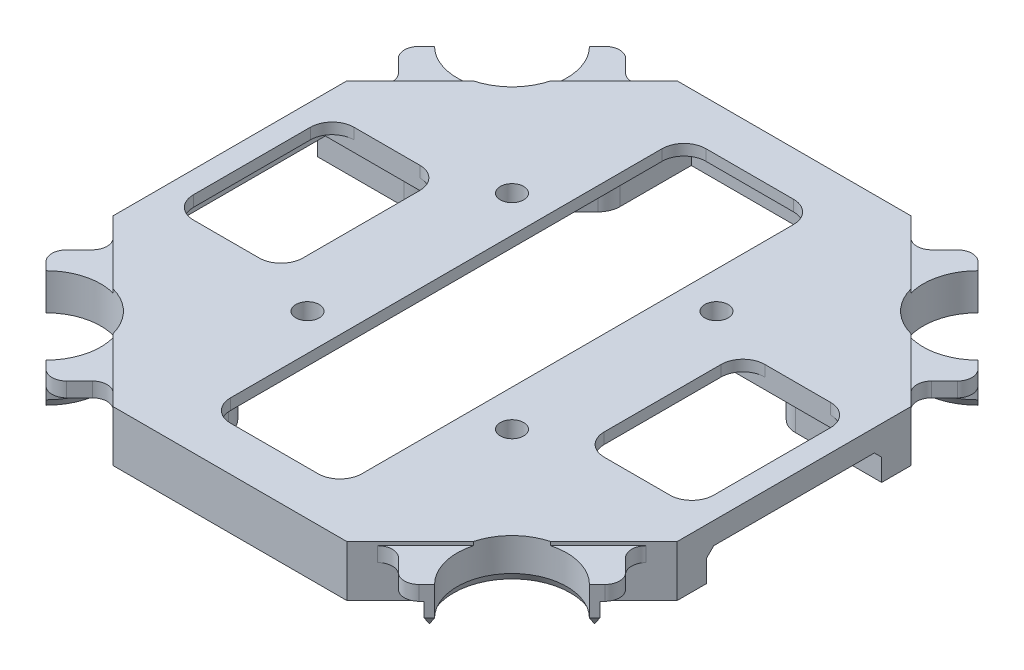
from build123d import *
from OCP.BRepFilletAPI import BRepFilletAPI_MakeChamfer
from build123d.topology import SkipClean

# Parameters (mm, degrees)
BOSS_EXTRUDE1_DEPTH     = 7
BOSS_EXTRUDE2_DEPTH     = 2.5
SKETCH3_R               = 11
CUT_EXTRUDE1_DEPTH      = 10
BOSS_EXTRUDE3_DEPTH     = 3
CUT_EXTRUDE2_START      = -4
SKETCH5_R               = 7.5
CUT_EXTRUDE2_DEPTH      = 4
CHAMFER1_SIZE           = 1
CHAMFER1_SIZE_2         = 0.5
FILLET1_R               = 2
FILLET2_R               = 2
CUT_EXTRUDE3_DEPTH      = 5.5
CUT_EXTRUDE3_DEPTH_BACK = 7
CUT_EXTRUDE3_START      = -7
SKETCH6_W               = 22
SKETCH6_H               = 10
SKETCH6_W_2             = 10
SKETCH6_H_2             = 22
SKETCH7_R               = 1.6
CUT_EXTRUDE4_DEPTH      = 17
CUT_EXTRUDE5_DEPTH      = 12
FILLET4_R               = 3
FILLET5_R               = 3
BOSS_EXTRUDE6_START     = 2
SKETCH9_R               = 1.6
BOSS_EXTRUDE6_DEPTH     = 1.5
CUT_EXTRUDE6_START      = -7
CUT_EXTRUDE6_DEPTH      = 4
FILLET6_R               = 3
SKETCH14_R              = 70.146484
CUT_EXTRUDE8_DEPTH      = 0.5
SKETCH15_W              = 2.071068
SKETCH15_H              = 24
CUT_EXTRUDE10_DEPTH     = 4
CHAMFER2_SIZE           = 1


# Some blends are built 0.0001 mm under size
with BuildPart() as part:
    # Sketch1 → Boss-Extrude1 (new body)
    with BuildSketch(Plane(origin=(0, 0, 0), x_dir=(1, 0, 0), z_dir=(0, 1, 0))):
        Polygon((38.627417, 16), (16, 38.627417), (-16, 38.627417), (-38.627417, 16), (-38.627417, -16), (-16, -38.627417), (16, -38.627417), (38.627417, -16), align=None)
    extrude(amount=BOSS_EXTRUDE1_DEPTH)

    # Sketch2 → Boss-Extrude2 (add)
    with BuildSketch(Plane(origin=(0, 7, 0), x_dir=(1, 0, 0), z_dir=(0, 1, 0))):
        Polygon((31.908164, 16.351641), (39.686455, 24.129873), (24.130164, 39.686281), (16.352047, 31.908223), align=None)
        Polygon((24.129873, -39.686455), (39.686281, -24.130164), (31.908223, -16.352047), (16.351641, -31.908164), align=None)
        Polygon((-39.686455, -24.129873), (-24.130164, -39.686281), (-16.352047, -31.908223), (-31.908164, -16.351641), align=None)
        Polygon((-24.129873, 39.686455), (-39.686281, 24.130164), (-31.908223, 16.352047), (-16.351641, 31.908164), align=None)
    extrude(amount=-BOSS_EXTRUDE2_DEPTH)

    # Sketch3 → Cut-Extrude1 (cut)
    with BuildSketch(Plane.XZ.offset(-4.5)):
        with Locations((31.908077, 31.90831)):
            Circle(SKETCH3_R)
        with Locations((31.90831, -31.908077)):
            Circle(SKETCH3_R)
        with Locations((-31.908077, -31.90831)):
            Circle(SKETCH3_R)
        with Locations((-31.90831, 31.908077)):
            Circle(SKETCH3_R)
    extrude(amount=CUT_EXTRUDE1_DEPTH, mode=Mode.SUBTRACT)

    # Sketch4 → Boss-Extrude3 (add)
    with BuildSketch(Plane(origin=(0, 4.5, 0), x_dir=(-1, 0, 0), z_dir=(0, -1, 0))):
        with BuildLine():
            Line((37.918508, 25.897925), (37.211398, 26.605029))
            ThreePointArc((37.211398, 26.605029), (26.604796, 26.604989), (26.604756, 37.211591))
            Line((26.604756, 37.211591), (25.897647, 37.918695))
            ThreePointArc((25.897647, 37.918695), (25.897692, 25.897879), (37.918508, 25.897925))
        make_face()
        with BuildLine():
            Line((25.897925, -37.918508), (26.605029, -37.211398))
            ThreePointArc((26.605029, -37.211398), (26.604989, -26.604796), (37.211591, -26.604756))
            Line((37.211591, -26.604756), (37.918695, -25.897647))
            ThreePointArc((37.918695, -25.897647), (25.897879, -25.897692), (25.897925, -37.918508))
        make_face()
        with BuildLine():
            Line((-37.918508, -25.897925), (-37.211398, -26.605029))
            ThreePointArc((-37.211398, -26.605029), (-26.604796, -26.604989), (-26.604756, -37.211591))
            Line((-26.604756, -37.211591), (-25.897647, -37.918695))
            ThreePointArc((-25.897647, -37.918695), (-25.897692, -25.897879), (-37.918508, -25.897925))
        make_face()
        with BuildLine():
            Line((-25.897925, 37.918508), (-26.605029, 37.211398))
            ThreePointArc((-26.605029, 37.211398), (-26.604989, 26.604796), (-37.211591, 26.604756))
            Line((-37.211591, 26.604756), (-37.918695, 25.897647))
            ThreePointArc((-37.918695, 25.897647), (-25.897879, 25.897692), (-25.897925, 37.918508))
        make_face()
    extrude(amount=BOSS_EXTRUDE3_DEPTH)

    # Sketch5 → Cut-Extrude2 (cut)
    with SkipClean():  # the faces are left unmerged after this step: merging them gives an invalid solid
        with BuildSketch(Plane(origin=(0, 4.5, 0), x_dir=(-1, 0, 0), z_dir=(0, -1, 0)).offset(CUT_EXTRUDE2_START)):
            with Locations((31.908077, 31.90831)):
                Circle(SKETCH5_R)
            with Locations((31.90831, -31.908077)):
                Circle(SKETCH5_R)
            with Locations((-31.908077, -31.90831)):
                Circle(SKETCH5_R)
            with Locations((-31.90831, 31.908077)):
                Circle(SKETCH5_R)
        extrude(amount=CUT_EXTRUDE2_DEPTH, mode=Mode.SUBTRACT)

    # Chamfer1
    chamfer1_edges_1 = [part.edges().sort_by_distance(p)[0] for p in [
        (-25.897692, 1.5, -25.897879),
    ]]
    chamfer1_side_1 = [part.faces().sort_by_distance(p)[0] for p in [
        (-25.897692, 1.51, -25.897879),
    ]]
    chamfer1_edges_2 = [part.edges().sort_by_distance(p)[0] for p in [
        (-25.897879, 1.5, 25.897692),
    ]]
    chamfer1_side_2 = [part.faces().sort_by_distance(p)[0] for p in [
        (-25.897879, 1.51, 25.897692),
    ]]
    chamfer1_edges_3 = [part.edges().sort_by_distance(p)[0] for p in [
        (26.604796, 1.5, 26.604989),
    ]]
    chamfer1_side_3 = [part.faces().sort_by_distance(p)[0] for p in [
        (26.597725, 1.5, 26.597918),
    ]]
    chamfer1_edges_4 = [part.edges().sort_by_distance(p)[0] for p in [
        (26.251202, 1.5, 37.565143),
    ]]
    chamfer1_side_4 = [part.faces().sort_by_distance(p)[0] for p in [
        (26.251202, 1.51, 37.565143),
    ]]
    chamfer1_edges_5 = [part.edges().sort_by_distance(p)[0] for p in [
        (25.897692, 1.5, 25.897879),
    ]]
    chamfer1_side_5 = [part.faces().sort_by_distance(p)[0] for p in [
        (25.897692, 1.51, 25.897879),
    ]]
    chamfer1_edges_6 = [part.edges().sort_by_distance(p)[0] for p in [
        (37.564953, 1.5, 26.251477),
    ]]
    chamfer1_side_6 = [part.faces().sort_by_distance(p)[0] for p in [
        (37.564953, 1.51, 26.251477),
    ]]
    chamfer1_edges_7 = [part.edges().sort_by_distance(p)[0] for p in [
        (25.897879, 1.5, -25.897692),
    ]]
    chamfer1_side_7 = [part.faces().sort_by_distance(p)[0] for p in [
        (25.897879, 1.51, -25.897692),
    ]]
    chamfer1 = BRepFilletAPI_MakeChamfer(part.part.solid().wrapped)
    for e in chamfer1_edges_1:
        chamfer1.Add(CHAMFER1_SIZE - 0.0001, CHAMFER1_SIZE_2 - 0.0001, e.wrapped, chamfer1_side_1[0].wrapped)
    for e in chamfer1_edges_2:
        chamfer1.Add(CHAMFER1_SIZE - 0.0001, CHAMFER1_SIZE_2 - 0.0001, e.wrapped, chamfer1_side_2[0].wrapped)
    for e in chamfer1_edges_3:
        chamfer1.Add(CHAMFER1_SIZE_2 - 0.0001, CHAMFER1_SIZE - 0.0001, e.wrapped, chamfer1_side_3[0].wrapped)
    for e in chamfer1_edges_4:
        chamfer1.Add(CHAMFER1_SIZE - 0.0001, CHAMFER1_SIZE_2 - 0.0001, e.wrapped, chamfer1_side_4[0].wrapped)
    for e in chamfer1_edges_5:
        chamfer1.Add(CHAMFER1_SIZE - 0.0001, CHAMFER1_SIZE_2 - 0.0001, e.wrapped, chamfer1_side_5[0].wrapped)
    for e in chamfer1_edges_6:
        chamfer1.Add(CHAMFER1_SIZE - 0.0001, CHAMFER1_SIZE_2 - 0.0001, e.wrapped, chamfer1_side_6[0].wrapped)
    for e in chamfer1_edges_7:
        chamfer1.Add(CHAMFER1_SIZE - 0.0001, CHAMFER1_SIZE_2 - 0.0001, e.wrapped, chamfer1_side_7[0].wrapped)
    add(Compound.cast(chamfer1.Shape()), mode=Mode.REPLACE)  # a hair under: the kernel refuses the full size

    # Fillet1
    fillet1_edges = [part.edges().sort_by_distance(p)[0] for p in [
        (-39.686281, 5.75, -24.130164),
        (-24.129873, 5.75, -39.686455),
        (-19.535435, 5.75, -35.091982),
        (-35.091784, 5.75, -19.535633),
        (24.130164, 5.75, -39.686281),
        (39.686455, 5.75, -24.129873),
        (35.091982, 5.75, -19.535435),
        (19.535633, 5.75, -35.091784),
        (-24.130164, 5.75, 39.686281),
        (-39.686455, 5.75, 24.129873),
        (-35.091982, 5.75, 19.535435),
        (-19.535633, 5.75, 35.091784),
        (19.535435, 5.75, 35.091982),
        (39.686281, 5.75, 24.130164),
        (24.129873, 5.75, 39.686455),
        (35.091784, 5.75, 19.535633),
    ]]
    fillet(fillet1_edges, radius=FILLET1_R)

    # Fillet2
    fillet2_edges = [part.edges().sort_by_distance(p)[0] for p in [
        (-21.037391, 2.25, -33.590026),
        (-33.589794, 2.25, -21.037623),
        (33.590026, 2.25, -21.037391),
        (21.037623, 2.25, -33.589794),
        (21.037391, 2.25, 33.590026),
        (33.589794, 2.25, 21.037623),
        (-21.037623, 2.25, 33.589794),
        (-33.590026, 2.25, 21.037391),
    ]]
    fillet(fillet2_edges, radius=FILLET2_R)

    # Sketch6 → Cut-Extrude3 (cut, two sides: drawn at the far end of the back side and taken through both)
    with SkipClean():  # the faces are left unmerged after this step: merging them gives an invalid solid
        with BuildSketch(Plane(origin=(0, 7, 0), x_dir=(1, 0, 0), z_dir=(0, 1, 0)).offset(CUT_EXTRUDE3_START - CUT_EXTRUDE3_DEPTH_BACK)):
            Polygon((11, -26.556349), (26.556349, -11), (26.556349, 11), (11, 26.556349), (-11, 26.556349), (-26.556349, 11), (-26.556349, -11), (-11, -26.556349), align=None)
            with Locations((0, 31.556349)):
                Rectangle(SKETCH6_W, SKETCH6_H)
            with Locations((-31.556349, 0)):
                Rectangle(SKETCH6_W_2, SKETCH6_H_2)
            with Locations((0, -31.556349)):
                Rectangle(SKETCH6_W, SKETCH6_H)
            with Locations((31.556349, 0)):
                Rectangle(SKETCH6_W_2, SKETCH6_H_2)
        extrude(amount=CUT_EXTRUDE3_DEPTH + CUT_EXTRUDE3_DEPTH_BACK, mode=Mode.SUBTRACT)

    # Sketch7 → Cut-Extrude4 (cut)
    with SkipClean():  # the faces are left unmerged after this step: merging them gives an invalid solid
        with BuildSketch(Plane(origin=(0, 2, 0), x_dir=(1, 0, 0), z_dir=(0, 1, 0))):
            with Locations(Location((-14, 14, 0), (0, 0, 270))):
                Circle(SKETCH7_R)
            with Locations(Location((14, 14, 0), (0, 0, 270))):
                Circle(SKETCH7_R)
            with Locations(Location((14, -14, 0), (0, 0, 270))):
                Circle(SKETCH7_R)
            with Locations(Location((-14, -14, 0), (0, 0, 270))):
                Circle(SKETCH7_R)
        extrude(amount=CUT_EXTRUDE4_DEPTH, mode=Mode.SUBTRACT)

    # Sketch8 → Cut-Extrude5 (cut)
    with SkipClean():  # the faces are left unmerged after this step: merging them gives an invalid solid
        with BuildSketch(Plane(origin=(0, 2, 0), x_dir=(1, 0, 0), z_dir=(0, 1, 0))):
            Polygon((35.627417, -11), (35.627417, 2), (35.627417, 11), (20.627417, 11), (20.627417, -11), align=None)
            Polygon((-9, -32.556349), (0, -32.556349), (0, 32.556349), (-9, 32.556349), (-9, 18.556349), (-9, -22.556349), align=None)
            Polygon((0, 32.556349), (0, -32.556349), (9, -32.556349), (9, -20.556349), (9, 20.556349), (9, 32.556349), align=None)
            Polygon((-35.627417, -11), (-20.627417, -11), (-20.627417, 11), (-35.627417, 11), (-35.627417, 2), align=None)
        extrude(amount=CUT_EXTRUDE5_DEPTH, mode=Mode.SUBTRACT)

    # Fillet4
    fillet4_edges = [part.edges().sort_by_distance(p)[0] for p in [
        (-9, 6.25, 32.556349),
        (9, 6.25, 32.556349),
        (9, 6.25, -32.556349),
        (-9, 6.25, -32.556349),
    ]]
    fillet(fillet4_edges, radius=FILLET4_R)

    # Fillet5
    # the kernel refuses this fillet: 3 mm, written as the material it adds along each edge
    with BuildSketch(Plane(origin=(-35.627417, 5.5, 11), x_dir=(0, 0, -1), z_dir=(0, 1, 0)), Plane(origin=(-20.627417, 5.5, -11), x_dir=(0, 0, 1), z_dir=(0, 1, 0)), Plane(origin=(-35.627417, 5.5, -11), x_dir=(1, 0, 0), z_dir=(0, 1, 0)), Plane(origin=(20.627417, 5.5, -11), x_dir=(1, 0, 0), z_dir=(0, 1, 0)), Plane(origin=(20.627417, 5.5, 11), x_dir=(0, 0, -1), z_dir=(0, 1, 0)), Plane(origin=(35.627417, 5.5, 11), x_dir=(-1, 0, 0), z_dir=(0, 1, 0))) as fillet5_piece_1:
        with BuildLine():
            CenterArc((FILLET5_R, -FILLET5_R), FILLET5_R, 90, 90)
            Line((0, -FILLET5_R), (0, 0))
            Line((0, 0), (FILLET5_R, 0))
        make_face()
    extrude(amount=1.5)
    with BuildSketch(Plane(origin=(-20.627417, 5.5, 11), x_dir=(0, 0, -1), z_dir=(0, 1, 0)), Plane(origin=(35.627417, 5.5, -11), x_dir=(-1, 0, 0), z_dir=(0, 1, 0))) as fillet5_piece_2:
        with BuildLine():
            CenterArc((FILLET5_R, FILLET5_R), FILLET5_R, 180, 90)
            Line((0, FILLET5_R), (0, 0))
            Line((0, 0), (FILLET5_R, 0))
        make_face()
    extrude(amount=1.5)

    # Sketch9 → Boss-Extrude6 (add)
    # profile 1 of 4: a face of its own
    with SkipClean():  # the faces are left unmerged after this step: merging them gives an invalid solid
        with BuildSketch(Plane(origin=(0, 2, 0), x_dir=(1, 0, 0), z_dir=(0, 1, 0)).offset(BOSS_EXTRUDE6_START)):
            with BuildLine():
                Line((-28.213203, 11), (-14, 11))
                ThreePointArc((-14, 11), (-11.87868, 11.87868), (-11, 14))
                Line((-11, 14), (-11, 28.213203))
                Line((-11, 28.213203), (-16.38809, 22.825113))
                Line((-16.38809, 22.825113), (-16.206293, 21.350057))
                Line((-16.206293, 21.350057), (-21.064872, 16.491477))
                Line((-21.064872, 16.491477), (-22.688831, 16.524372))
                Line((-22.688831, 16.524372), (-28.213203, 11))
            make_face()
            with Locations(Location((-14, 14, 0), (0, 0, 270))):
                Circle(SKETCH9_R, mode=Mode.SUBTRACT)
        # profile 2 of 4: a face of its own
        with BuildSketch(Plane(origin=(0, 2, 0), x_dir=(1, 0, 0), z_dir=(0, 1, 0)).offset(BOSS_EXTRUDE6_START)):
            with BuildLine():
                Line((11, 28.213203), (11, 14))
                ThreePointArc((11, 14), (11.87868, 11.87868), (14, 11))
                Line((14, 11), (28.213203, 11))
                Line((28.213203, 11), (22.825113, 16.38809))
                Line((22.825113, 16.38809), (21.350057, 16.206293))
                Line((21.350057, 16.206293), (16.491477, 21.064872))
                Line((16.491477, 21.064872), (16.524372, 22.688831))
                Line((16.524372, 22.688831), (11, 28.213203))
            make_face()
            with Locations(Location((14, 14, 0), (0, 0, 270))):
                Circle(SKETCH9_R, mode=Mode.SUBTRACT)
        # profile 3 of 4: a face of its own
        with BuildSketch(Plane(origin=(0, 2, 0), x_dir=(1, 0, 0), z_dir=(0, 1, 0)).offset(BOSS_EXTRUDE6_START)):
            with BuildLine():
                Line((28.213203, -11), (14, -11))
                ThreePointArc((14, -11), (11.87868, -11.87868), (11, -14))
                Line((11, -14), (11, -28.213203))
                Line((11, -28.213203), (16.38809, -22.825113))
                Line((16.38809, -22.825113), (16.206293, -21.350057))
                Line((16.206293, -21.350057), (21.064872, -16.491477))
                Line((21.064872, -16.491477), (22.688831, -16.524372))
                Line((22.688831, -16.524372), (28.213203, -11))
            make_face()
            with Locations(Location((14, -14, 0), (0, 0, 270))):
                Circle(SKETCH9_R, mode=Mode.SUBTRACT)
        # profile 4 of 4: a face of its own
        with BuildSketch(Plane(origin=(0, 2, 0), x_dir=(1, 0, 0), z_dir=(0, 1, 0)).offset(BOSS_EXTRUDE6_START)):
            with BuildLine():
                Line((-11, -28.213203), (-11, -14))
                ThreePointArc((-11, -14), (-11.87868, -11.87868), (-14, -11))
                Line((-14, -11), (-28.213203, -11))
                Line((-28.213203, -11), (-22.825113, -16.38809))
                Line((-22.825113, -16.38809), (-21.350057, -16.206293))
                Line((-21.350057, -16.206293), (-16.491477, -21.064872))
                Line((-16.491477, -21.064872), (-16.524372, -22.688831))
                Line((-16.524372, -22.688831), (-11, -28.213203))
            make_face()
            with Locations(Location((-14, -14, 0), (0, 0, 270))):
                Circle(SKETCH9_R, mode=Mode.SUBTRACT)
        extrude(amount=BOSS_EXTRUDE6_DEPTH)

    # Sketch12 → Cut-Extrude6 (cut)
    with SkipClean():  # the faces are left unmerged after this step: merging them gives an invalid solid
        with BuildSketch(Plane(origin=(0, 7, 0), x_dir=(1, 0, 0), z_dir=(0, 1, 0)).offset(CUT_EXTRUDE6_START)):
            Polygon((-36.556349, 0), (-36.556349, 12), (-12, 12), (-12, 36.556349), (0, 36.556349), (12, 36.556349), (12, 12), (36.556349, 12), (36.556349, 0), (36.556349, -12), (12, -12), (12, -36.556349), (0, -36.556349), (-12, -36.556349), (-12, -12), (-36.556349, -12), align=None)
        extrude(amount=CUT_EXTRUDE6_DEPTH, mode=Mode.SUBTRACT)

    # Fillet6
    fillet6_edges = [part.edges().sort_by_distance(p)[0] for p in [
        (-25.556349, 2, 12),
        (-12, 2, 25.556349),
        (12, 2, 25.556349),
        (25.556349, 2, 12),
        (25.556349, 2, -12),
        (12, 2, -25.556349),
        (-12, 2, -25.556349),
        (-25.556349, 2, -12),
    ]]
    fillet(fillet6_edges, radius=FILLET6_R)

    # Sketch14 → Cut-Extrude8 (cut)
    with SkipClean():  # the faces are left unmerged after this step: merging them gives an invalid solid
        with BuildSketch(Plane(origin=(0, 7, 0), x_dir=(1, 0, 0), z_dir=(0, 1, 0))):
            Circle(SKETCH14_R)
            Polygon((38.627417, 16), (16, 38.627417), (-16, 38.627417), (-38.627417, 16), (-38.627417, -16), (-16, -38.627417), (16, -38.627417), (38.627417, -16), align=None, mode=Mode.SUBTRACT)
        extrude(amount=-CUT_EXTRUDE8_DEPTH, mode=Mode.SUBTRACT)

    # Sketch15 → Cut-Extrude10 (cut)
    with SkipClean():  # the faces are left unmerged after this step: merging them gives an invalid solid
        with BuildSketch(Plane.XZ.offset(-4)):
            with Locations((-37.591883, 0)):
                Rectangle(SKETCH15_W, SKETCH15_H)
            with Locations((37.591883, 0)):
                Rectangle(SKETCH15_W, SKETCH15_H)
        extrude(amount=CUT_EXTRUDE10_DEPTH, mode=Mode.SUBTRACT)

    # Chamfer2
    chamfer2_edges = [part.edges().sort_by_distance(p)[0] for p in [
        (12, 4, 31.67767),
        (12.228361, 4, 25.65094),
        (18.635582, 4, 18.920767),
        (25.65094, 4, 12.228361),
        (31.67767, 4, 12),
        (12, 4, -31.67767),
        (12.228361, 4, -25.65094),
        (18.920767, 4, -18.635582),
        (25.65094, 4, -12.228361),
        (31.67767, 4, -12),
        (-12, 4, -31.67767),
        (-12.228361, 4, -25.65094),
        (-18.635582, 4, -18.920767),
        (-25.65094, 4, -12.228361),
        (-31.67767, 4, -12),
        (-12, 4, 31.67767),
        (-12.228361, 4, 25.65094),
        (-18.920767, 4, 18.635582),
        (-25.65094, 4, 12.228361),
        (-31.67767, 4, 12),
    ]]
    chamfer(chamfer2_edges, length=CHAMFER2_SIZE - 0.0001)  # a hair under: the kernel refuses the full size


solid = part.part
